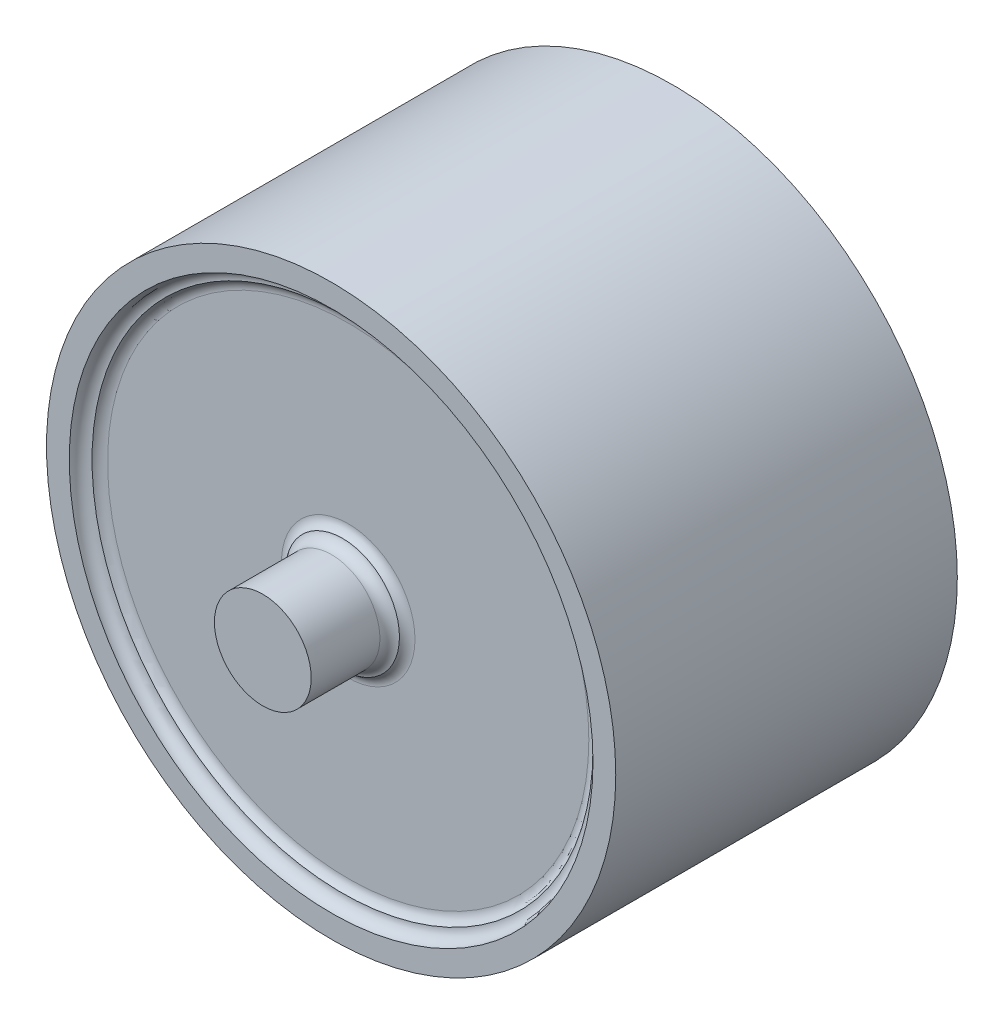
from build123d import *

# Parameters (mm, degrees)
BOSS_EXTRUDE1_DEPTH      = 150
BOSS_EXTRUDE1_DEPTH_BACK = 150
SKETCH1_R                = 250
SKETCH2_R                = 230
CUT_EXTRUDE2_DEPTH       = 10
SKETCH3_R                = 220
CUT_EXTRUDE3_DEPTH       = 5
FILLET1_R                = 10
FILLET2_R                = 10
SKETCH4_R                = 50
BOSS_EXTRUDE2_DEPTH      = 5
SKETCH5_R                = 42.5
BOSS_EXTRUDE3_DEPTH      = 70
BOSS_EXTRUDE4_START      = 5
SKETCH6_R                = 50
BOSS_EXTRUDE4_DEPTH      = 5
FILLET3_R                = 10
SCALE1_SCALE             = 0.8


# Some blends are built 0.0001 mm under size
with BuildPart() as part:
    # Sketch1 → Boss-Extrude1 (new, two sides: drawn at the far end of the back side and taken through both)
    with BuildSketch(Plane.XY.offset(-BOSS_EXTRUDE1_DEPTH_BACK)):
        Circle(SKETCH1_R)
    extrude(amount=BOSS_EXTRUDE1_DEPTH + BOSS_EXTRUDE1_DEPTH_BACK)

    # Sketch2 → Cut-Extrude2 (cut)
    with BuildSketch(Plane.XY.offset(150)):
        Circle(SKETCH2_R)
    extrude(amount=-CUT_EXTRUDE2_DEPTH, mode=Mode.SUBTRACT)

    # Sketch3 → Cut-Extrude3 (cut)
    with BuildSketch(Plane.XY.offset(140)):
        Circle(SKETCH3_R)
    extrude(amount=-CUT_EXTRUDE3_DEPTH, mode=Mode.SUBTRACT)

    # Fillet1
    fillet1_edges = [part.edges().sort_by_distance(p)[0] for p in [
        (-230, 0, 140),
    ]]
    fillet(fillet1_edges, radius=FILLET1_R - 0.0001)  # a hair under: the kernel refuses the full size

    # Fillet2
    # the kernel refuses this fillet: 10 mm, written as the material it adds along each edge
    with BuildSketch(Plane(origin=(0, 0, 135), x_dir=(1, 0, 0), z_dir=(0, -1, 0))) as fillet2_piece_1:
        with BuildLine():
            CenterArc((211.339745962, 10), FILLET2_R, 270, 60)
            Line((211.339745962, 0), (211.339745962, -0.2))
            Line((211.339745962, -0.2), (220, -0.2))
            Line((220, -0.2), (220.2, 0))
            ThreePointArc((220.2, 0), (220.2, 2.5), (220.173205081, 4.9))
            Line((220.173205081, 4.9), (220, 5))
        make_face()
    revolve(axis=Axis((0, 0, 135), (0, 0, 1)))

    # Sketch4 → Boss-Extrude2 (add)
    with BuildSketch(Plane.XY.offset(135)):
        Circle(SKETCH4_R)
    extrude(amount=BOSS_EXTRUDE2_DEPTH)

    # Sketch5 → Boss-Extrude3 (add)
    with BuildSketch(Plane.XY.offset(140)):
        Circle(SKETCH5_R)
    extrude(amount=BOSS_EXTRUDE3_DEPTH)

    # Sketch6 → Boss-Extrude4 (add)
    with BuildSketch(Plane(origin=(0, 0, -150), x_dir=(-1, 0, 0), z_dir=(0, 0, -1)).offset(BOSS_EXTRUDE4_START)):
        with Locations(Location((0, 0, 0), (0, 0, 180))):
            Circle(SKETCH6_R)
    extrude(amount=-BOSS_EXTRUDE4_DEPTH)

    # Fillet3
    # the kernel refuses this fillet: 10 mm, written as the material it adds along each edge
    with BuildSketch(Plane(origin=(0, 0, 135), x_dir=(1, 0, 0), z_dir=(0, -1, 0))) as fillet3_piece_1:
        with BuildLine():
            CenterArc((58.660254038, 10), FILLET3_R, 210, 60)
            Line((50, 5), (49.826794919, 4.9))
            ThreePointArc((49.826794919, 4.9), (49.8, 2.5), (49.8, 0))
            Line((49.8, 0), (50, -0.2))
            Line((50, -0.2), (58.660254038, -0.2))
            Line((58.660254038, -0.2), (58.660254038, 0))
        make_face()
    revolve(axis=Axis((0, 0, 135), (0, 0, 1)))
    with BuildSketch(Plane(origin=(0, 0, 140), x_dir=(1, 0, 0), z_dir=(0, -1, 0))) as fillet3_piece_2:
        with BuildLine():
            CenterArc((52.5, 9.682458366), FILLET3_R, 180, 75.522487814)
            Line((42.5, 9.682458366), (42.3, 9.682458366))
            Line((42.3, 9.682458366), (42.3, 0))
            Line((42.3, 0), (42.5, -0.2))
            ThreePointArc((42.5, -0.2), (46.25, -0.2), (49.95, -0.193649167))
            Line((49.95, -0.193649167), (50, 0))
        make_face()
    revolve(axis=Axis((0, 0, 140), (0, 0, 1)))


with BuildPart() as part_1:
    # Scale1: scaled about (0, 0, -4.710262046)
    add(part.part.scale(SCALE1_SCALE).moved(Location((0, 0, -0.942052409))))


solid = part_1.part
